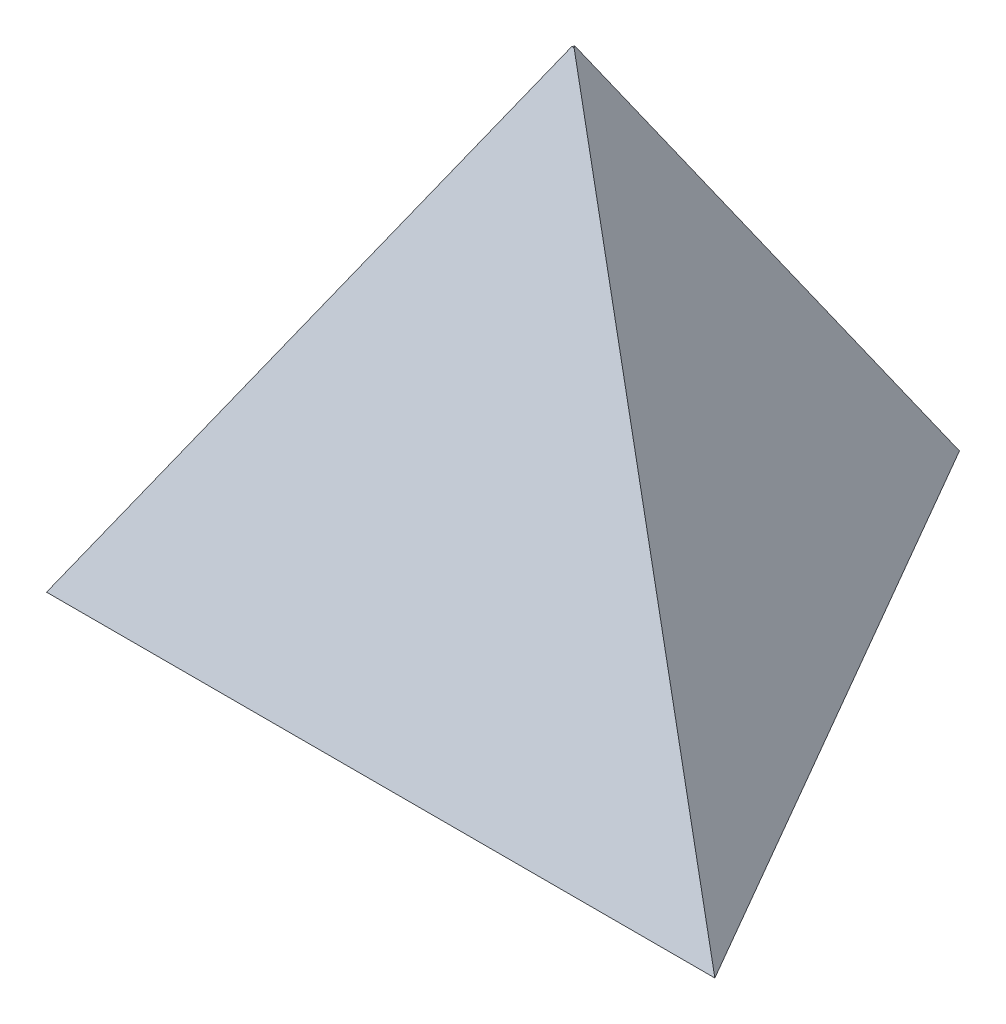
from build123d import *

# Parameters (mm, degrees)
BOSS_EXTRUDE1_DEPTH = 65
BOSS_EXTRUDE1_TAPER = 19.5
SHELL1_T            = -2
CUT_EXTRUDE1_DEPTH  = 5
CUT_EXTRUDE1_DRAFT  = 19.5
CUT_EXTRUDE2_DEPTH  = 11


with BuildPart() as part:
    # Sketch1 → Boss-Extrude1 (new body)
    with BuildSketch(Plane(origin=(0, 0, 0), x_dir=(1, 0, 0), z_dir=(0, 1, 0))):
        Polygon((40, -23.094010768), (0, 46.188021535), (-40, -23.094010768), align=None)
    extrude(amount=BOSS_EXTRUDE1_DEPTH, taper=BOSS_EXTRUDE1_TAPER)

    # Shell1
    shell1_openings = [part.faces().sort_by_distance(p)[0] for p in [
        (0, 0, 0),
    ]]
    offset(amount=SHELL1_T, openings=shell1_openings)


with BuildPart() as cut_extrude1_tool:
    # Sketch4 → Cut-Extrude1 (with draft: the straight prism first)
    with BuildSketch(Plane(origin=(0, 0, 0), x_dir=(1, 0, 0), z_dir=(0, 1, 0))):
        Polygon((37.19113771, -21.472313368), (0, 42.944626737), (-37.19113771, -21.472313368), align=None)
        Polygon((30, -17.320508076), (0, 34.641016151), (-30, -17.320508076), align=None, mode=Mode.SUBTRACT)
    extrude(amount=CUT_EXTRUDE1_DEPTH)
    # Cut-Extrude1: the draft: its side faces are tilted about the plane it starts from
    cut_extrude1_sides = [cut_extrude1_tool.faces().sort_by_distance(p)[0] for p in [
        (18.595568855, 2.5, -10.736156684),
        (-18.595568855, 2.5, -10.736156684),
        (0, 2.5, 21.472313368),
        (0, 2.5, 17.320508076),
        (-15, 2.5, -8.660254038),
        (15, 2.5, -8.660254038),
    ]]
    draft(cut_extrude1_sides, Plane(origin=(0, 0, 0), x_dir=(1, 0, 0), z_dir=(0, 1, 0)), CUT_EXTRUDE1_DRAFT)


with BuildPart() as part_1:
    add(part.part)

    # Cut-Extrude1: cut by cut_extrude1_tool
    add(cut_extrude1_tool.part, mode=Mode.SUBTRACT)

    # Sketch6 → Cut-Extrude2 (cut)
    with BuildSketch(Plane.XZ):
        Polygon((30, 17.320508076), (-30, 17.320508076), (0, -34.641016151), align=None)
    extrude(amount=-CUT_EXTRUDE2_DEPTH, mode=Mode.SUBTRACT)


solid = part_1.part
